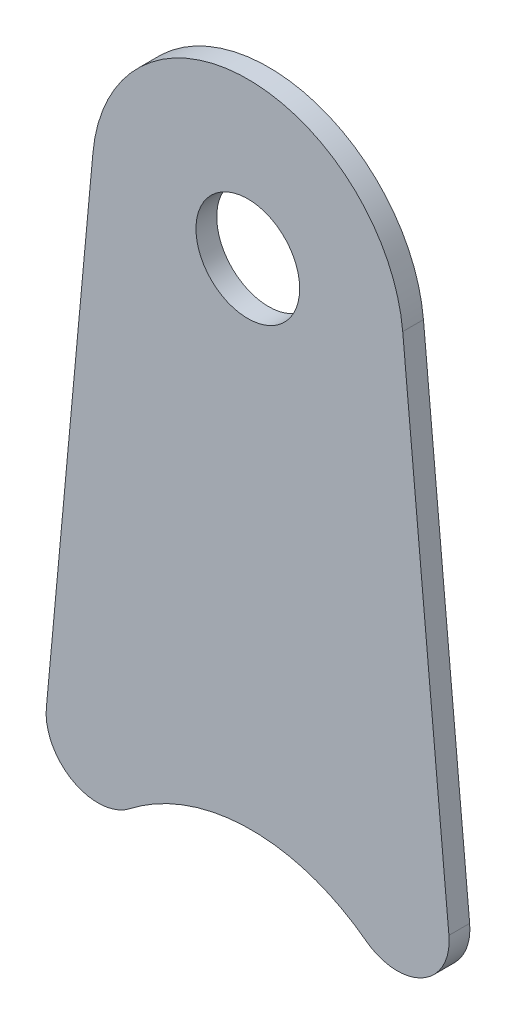
from build123d import *

# Parameters (mm, degrees)
SKETCH1_R           = 3.175
BOSS_EXTRUDE1_DEPTH = 0.635
CUT_EXTRUDE1_START  = -0.635
CUT_EXTRUDE1_DEPTH  = 1.27
CUT_EXTRUDE2_DEPTH  = 37.222840302


# Read off the part's stored shape, not the designer's step: Cut-Extrude1
with BuildPart() as part:
    # Sketch1 → Boss-Extrude1 (new, symmetric)
    with BuildSketch(Plane.XY):
        with BuildLine():
            Line((-9.484545184, 0.876942223), (-12.7, -33.89972345))
            Line((-12.7, -33.89972345), (12.7, -33.89972345))
            Line((12.7, -33.89972345), (9.484545184, 0.876942223))
            ThreePointArc((9.484545184, 0.876942223), (0, 9.525), (-9.484545184, 0.876942223))
        make_face()
        Circle(SKETCH1_R, mode=Mode.SUBTRACT)
    extrude(amount=BOSS_EXTRUDE1_DEPTH, both=True)

    # Cut-Extrude1 outline → Cut-Extrude1 (cut)
    with BuildSketch(Plane.XY.offset(CUT_EXTRUDE1_START)):
        with BuildLine():
            Line((-8.497954961, -33.89972345), (8.76063713, -33.89972345))
            add(Edge.make_bspline(
                [(8.76063713, -33.89972345), (0.306373234, -25.111661594), (-8.497954961, -33.89972345)],
                knots=[2.496380088, 2.496380088, 2.496380088, 3.988409978, 3.988409978, 3.988409978], degree=2, weights=[1, 0.73439942, 1]))
        make_face()
    extrude(amount=CUT_EXTRUDE1_DEPTH, mode=Mode.SUBTRACT)

    # Sketch3 → Cut-Extrude2 (cut, through all)
    with BuildSketch(Plane.XY.offset(0.635)):
        with BuildLine():
            Line((8.76063713, -33.89972345), (12.7, -33.89972345))
            Line((12.7, -33.89972345), (12.314154974, -29.726626876))
            ThreePointArc((12.314154974, -29.726626876), (10.7009799, -32.790811849), (7.245953049, -32.557674927))
            add(Edge.make_bspline(
                [(8.76063713, -33.89972345), (8.051791445, -33.162890557), (7.245953049, -32.557674927)],
                knots=[2.496380088, 2.496380088, 2.496380088, 2.651046381, 2.651046381, 2.651046381], degree=2, weights=[1, 0.997011282, 1]))
        make_face()
        with BuildLine():
            Line((-12.7, -33.89972345), (-8.497954961, -33.89972345))
            add(Edge.make_bspline(
                [(-7.23241505, -32.785101753), (-7.896265785, -33.299145918), (-8.497954961, -33.89972345)],
                knots=[3.862260272, 3.862260272, 3.862260272, 3.988409978, 3.988409978, 3.988409978], degree=2, weights=[1, 0.998011441, 1]))
            ThreePointArc((-7.23241505, -32.785101753), (-10.704172961, -33.057927648), (-12.337805101, -29.982414196))
            Line((-12.337805101, -29.982414196), (-12.7, -33.89972345))
        make_face()
    extrude(amount=-CUT_EXTRUDE2_DEPTH, mode=Mode.SUBTRACT)


solid = part.part
